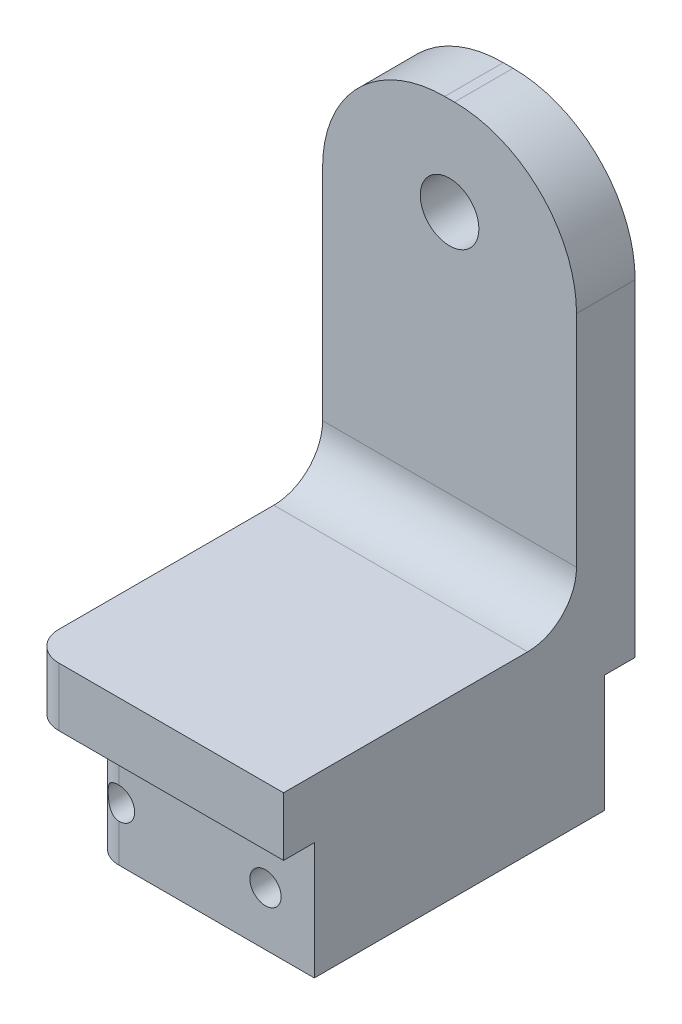
from build123d import *

# Parameters (mm, degrees)
BOSS_EXTRUDE1_DEPTH = 6
SKETCH2_W           = 26
SKETCH2_H           = 6
BOSS_EXTRUDE2_DEPTH = 40
FILLET1_R           = 12.5
SKETCH3_R           = 3
CUT_EXTRUDE1_DEPTH  = 74.228954843
BOSS_EXTRUDE3_DEPTH = 12
FILLET2_R           = 5
SKETCH5_R           = 1.6
CUT_EXTRUDE2_DEPTH  = 83.107261112
CUT_EXTRUDE3_DEPTH  = 71.074815928


with BuildPart() as part:
    # Sketch1 → Boss-Extrude1 (new body)
    with BuildSketch(Plane(origin=(0, -44, 0), x_dir=(1, 0, 0), z_dir=(0, 1, 0))):
        with BuildLine():
            Line((50.264100782, -8), (50.264100782, 28))
            Line((50.264100782, 28), (27.264100782, 28))
            ThreePointArc((27.264100782, 28), (25.142780438, 27.121320344), (24.264100782, 25))
            Line((24.264100782, 25), (24.264100782, -5))
            ThreePointArc((24.264100782, -5), (25.142780438, -7.121320344), (27.264100782, -8))
            Line((27.264100782, -8), (50.264100782, -8))
        make_face()
    extrude(amount=BOSS_EXTRUDE1_DEPTH)

    # Sketch2 → Boss-Extrude2 (add)
    with BuildSketch(Plane(origin=(0, -38, 0), x_dir=(1, 0, 0), z_dir=(0, 1, 0))):
        with Locations((37.264100782, 25)):
            Rectangle(SKETCH2_W, SKETCH2_H)
    extrude(amount=BOSS_EXTRUDE2_DEPTH)

    # Fillet1
    fillet1_edges = [part.edges().sort_by_distance(p)[0] for p in [
        (24.264100782, 2, -25),
        (50.264100782, 2, -25),
    ]]
    fillet(fillet1_edges, radius=FILLET1_R)

    # Sketch3 → Cut-Extrude1 (cut, through all)
    with BuildSketch(Plane.XY.offset(-22)):
        with Locations((37.264100782, -8)):
            Circle(SKETCH3_R)
    extrude(amount=-CUT_EXTRUDE1_DEPTH, mode=Mode.SUBTRACT)

    # Sketch4 → Boss-Extrude3 (add)
    with BuildSketch(Plane.XZ.offset(44)):
        with BuildLine():
            Line((50.264100782, 4.85), (50.264100782, -24.85))
            Line((50.264100782, -24.85), (30.264100782, -24.85))
            ThreePointArc((30.264100782, -24.85), (28.248846455, -24.015254326), (27.414100782, -22))
            Line((27.414100782, -22), (27.414100782, 2))
            ThreePointArc((27.414100782, 2), (28.248846455, 4.015254326), (30.264100782, 4.85))
            Line((30.264100782, 4.85), (50.264100782, 4.85))
        make_face()
    extrude(amount=BOSS_EXTRUDE3_DEPTH)

    # Fillet2
    fillet2_edges = [part.edges().sort_by_distance(p)[0] for p in [
        (37.264100782, -38, -22),
    ]]
    fillet(fillet2_edges, radius=FILLET2_R)

    # Sketch5 → Cut-Extrude2 (cut, through all)
    with BuildSketch(Plane(origin=(0, 0, -24.85), x_dir=(-1, 0, 0), z_dir=(0, 0, -1))):
        with Locations((-45.264100782, -50.5)):
            Circle(SKETCH5_R)
        with Locations((-30.264100782, -50.5)):
            Circle(SKETCH5_R)
    extrude(amount=-CUT_EXTRUDE2_DEPTH, mode=Mode.SUBTRACT)

    # Sketch6 → Cut-Extrude3 (cut, through all)
    with BuildSketch(Plane.XZ.offset(38)):
        with BuildLine():
            Line((24.264100782, -28), (27.264100782, -28))
            ThreePointArc((27.264100782, -28), (25.142780438, -27.121320344), (24.264100782, -25))
            Line((24.264100782, -25), (24.264100782, -28))
        make_face()
    extrude(amount=-CUT_EXTRUDE3_DEPTH, mode=Mode.SUBTRACT)


solid = part.part
